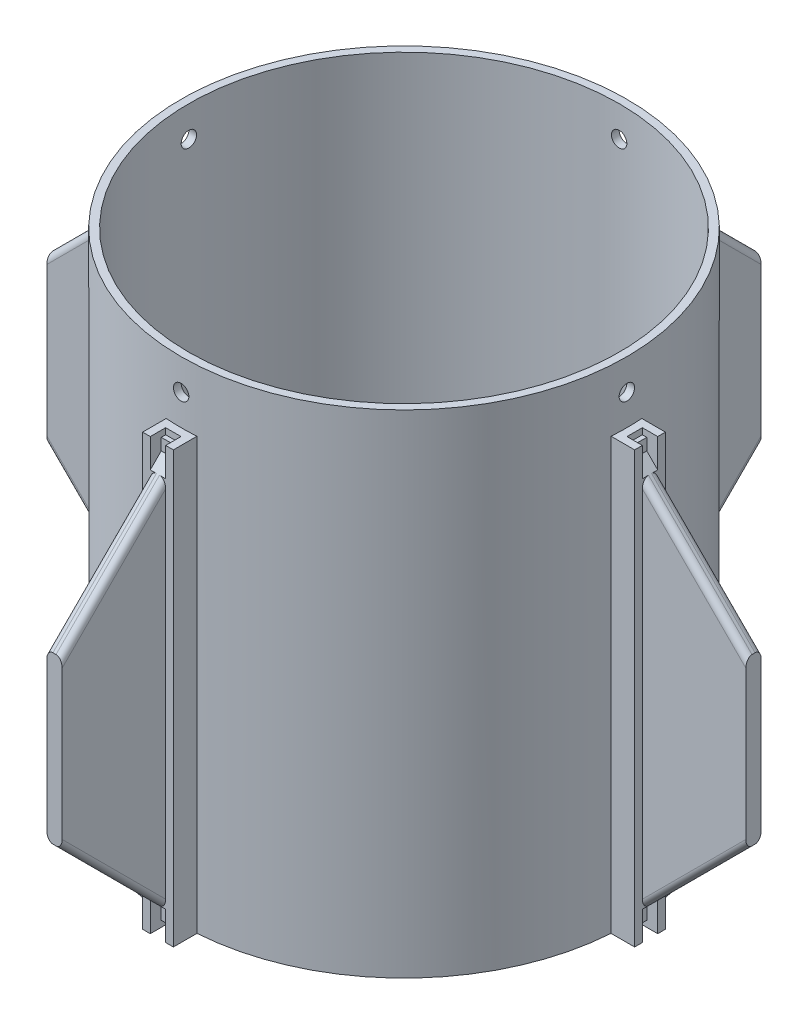
from build123d import *

# Parameters (mm, degrees)
SKETCH1_R               = 92.075
SKETCH1_R_2             = 88.9
BASE_SHELL_DEPTH        = 203.2
SKETCH2_R               = 88.9
SKETCH2_R_2             = 3.175
SKETCH2_R_3             = 3.174999998
SKETCH2_R_4             = 3.174999999
SKETCH2_R_5             = 3.175000001
BOLT_INSERT_DEPTH       = 6.35
FIN_BRACKET_DEPTH       = 177.8
CIRPATTERN1_COUNT       = 4
BASE_FIN_DEPTH          = 3.175
FIN_PATTERN_COUNT       = 4
FIN_FILLETS_R           = 2.54
CUT_EXTRUDE1_DEPTH      = 289.02456558
CUT_EXTRUDE1_DEPTH_BACK = 289.02456558
SKETCH5_R               = 3.175
CUT_EXTRUDE2_DEPTH      = 289.02456565
CUT_EXTRUDE2_DEPTH_BACK = 289.02456565
SKETCH6_R               = 3.175


with BuildPart() as part:
    # Sketch1 → Base Shell (new body)
    with BuildSketch(Plane(origin=(0, 0, 0), x_dir=(1, 0, 0), z_dir=(0, 1, 0))):
        Circle(SKETCH1_R)
        Circle(SKETCH1_R_2, mode=Mode.SUBTRACT)
    extrude(amount=BASE_SHELL_DEPTH)

    # Sketch2 → Bolt Insert (add)
    with BuildSketch(Plane.XZ):
        Circle(SKETCH2_R)
        with Locations((0, 79.375)):
            Circle(SKETCH2_R_2, mode=Mode.SUBTRACT)
        with Locations((79.375000001, -1e-09)):
            Circle(SKETCH2_R_3, mode=Mode.SUBTRACT)
        with Locations((0, -79.375000003)):
            Circle(SKETCH2_R_4, mode=Mode.SUBTRACT)
        with Locations((-79.375000001, -1e-09)):
            Circle(SKETCH2_R_5, mode=Mode.SUBTRACT)
        with BuildLine():
            ThreePointArc((-78.8035, -9.507839542), (-56.126600757, -56.126600757), (-9.507839542, -78.8035))
            ThreePointArc((-9.507839542, -78.8035), (0, -69.85), (9.507839542, -78.8035))
            ThreePointArc((9.507839542, -78.8035), (56.126600757, -56.126600757), (78.8035, -9.507839542))
            ThreePointArc((78.8035, -9.507839542), (69.85, 0), (78.8035, 9.507839542))
            ThreePointArc((78.8035, 9.507839542), (56.126600757, 56.126600757), (9.507839542, 78.8035))
            ThreePointArc((9.507839542, 78.8035), (0, 69.85), (-9.507839542, 78.8035))
            ThreePointArc((-9.507839542, 78.8035), (-56.126600757, 56.126600757), (-78.8035, 9.507839542))
            ThreePointArc((-78.8035, 9.507839542), (-69.85, 0), (-78.8035, -9.507839542))
        make_face(mode=Mode.SUBTRACT)
    extrude(amount=-BOLT_INSERT_DEPTH)

    # Sketch3 → Fin Bracket (add)
    with BuildSketch(Plane(origin=(0, 0, 0), x_dir=(1, 0, 0), z_dir=(0, 1, 0))):
        with BuildLine():
            Line((-3.175, 101.6), (-6.35, 101.6))
            Line((-6.35, 101.6), (-6.35, 91.855773498))
            ThreePointArc((-6.35, 91.855773498), (0, 92.075), (6.35, 91.855773498))
            Line((6.35, 91.855773498), (6.35, 101.6))
            Line((6.35, 101.6), (3.175, 101.6))
            Line((3.175, 101.6), (3.175, 95.25))
            Line((3.175, 95.25), (-3.175, 95.25))
            Line((-3.175, 95.25), (-3.175, 101.6))
        make_face()
    fin_bracket = extrude(amount=FIN_BRACKET_DEPTH)

    # CirPattern1: Fin Bracket ×4 about axis
    cirpattern1_axis = Axis((0, 203.2, 0), (0, -1, 0))
    for i in range(1, CIRPATTERN1_COUNT):
        add(fin_bracket.rotate(cirpattern1_axis, i * 360 / CIRPATTERN1_COUNT))

    # Sketch4 → Base Fin (add, symmetric)
    with BuildSketch(Plane.XY):
        Polygon((91.855773498, 175.26), (91.855773498, 2.54), (97.071111515, 2.54), (97.071111515, 7.402102448), (144.339721451, 54.670712385), (144.339721451, 123.129287615), (97.071111515, 170.397897552), (97.071111515, 175.26), align=None)
    base_fin = extrude(amount=BASE_FIN_DEPTH, both=True)

    # Fin Pattern: Base Fin ×4 about axis
    fin_pattern_axis = Axis((0, 203.2, 0), (0, -1, 0))
    for i in range(1, FIN_PATTERN_COUNT):
        add(base_fin.rotate(fin_pattern_axis, i * 360 / FIN_PATTERN_COUNT))

    # Fin Fillets
    fin_fillets_edges = [part.edges().sort_by_distance(p)[0] for p in [
        (122.969860726, 33.300851659, 3.175),
        (122.969860726, 33.300851659, -3.175),
        (122.969860726, 144.499148341, -3.175),
        (122.969860726, 144.499148341, 3.175),
        (3.175, 33.300851659, -122.969860726),
        (-3.175, 33.300851659, -122.969860726),
        (3.175, 144.499148341, -122.969860726),
        (-3.175, 144.499148341, -122.969860726),
        (-122.969860726, 144.499148341, 3.175),
        (-122.969860726, 144.499148341, -3.175),
        (-122.969860726, 33.300851659, -3.175),
        (-122.969860726, 33.300851659, 3.175),
        (3.175, 33.300851659, 122.969860726),
        (-3.175, 33.300851659, 122.969860726),
        (3.175, 144.499148341, 122.969860726),
        (-3.175, 144.499148341, 122.969860726),
    ]]
    fillet(fin_fillets_edges, radius=FIN_FILLETS_R)

    # Sketch5 → Cut-Extrude1 (cut, two sides: drawn at the far end of the back side and taken through both)
    with BuildSketch(Plane.XY.offset(-CUT_EXTRUDE1_DEPTH_BACK)):
        with Locations((0, 190.5)):
            Circle(SKETCH5_R)
    extrude(amount=CUT_EXTRUDE1_DEPTH + CUT_EXTRUDE1_DEPTH_BACK, mode=Mode.SUBTRACT)

    # Sketch6 → Cut-Extrude2 (cut, two sides: drawn at the far end of the back side and taken through both)
    with BuildSketch(Plane(origin=(0, 0, 0), x_dir=(0, 0, -1), z_dir=(1, 0, 0)).offset(-CUT_EXTRUDE2_DEPTH_BACK)):
        with Locations((0, 190.5)):
            Circle(SKETCH6_R)
    extrude(amount=CUT_EXTRUDE2_DEPTH + CUT_EXTRUDE2_DEPTH_BACK, mode=Mode.SUBTRACT)


solid = part.part
